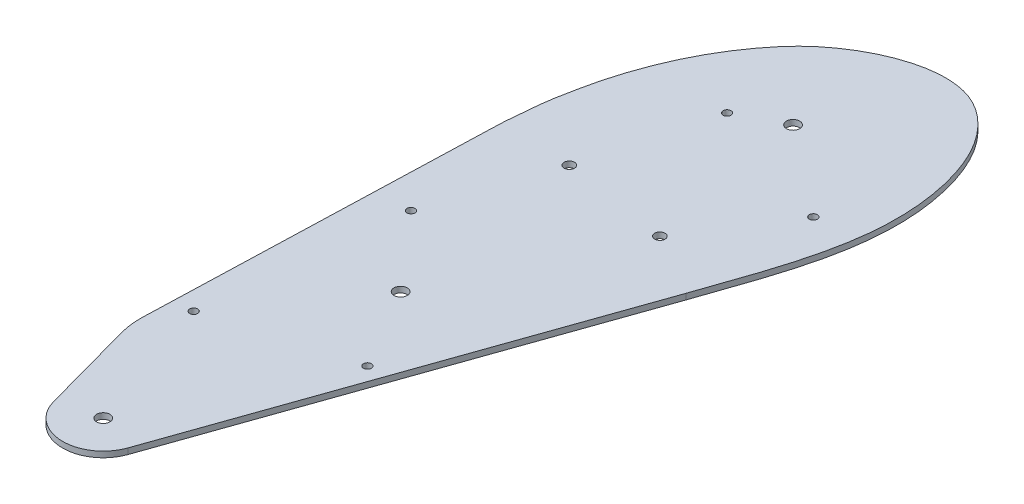
from build123d import *

# Parameters (mm, degrees)
SKETCH1_R           = 2.455
SKETCH1_R_2         = 1.475
SKETCH1_R_3         = 1.925
BOSS_EXTRUDE1_DEPTH = 2.15


with BuildPart() as part:
    # Sketch1 → Boss-Extrude1 (new body)
    with BuildSketch(Plane(origin=(0, 0, 0), x_dir=(1, 0, 0), z_dir=(0, 1, 0))):
        with BuildLine():
            Line((-82.919787444, -128.698908445), (-29.140629004, 24.317395253))
            add(Edge.make_bspline(
                [(-29.140629004, 24.317395253), (-23.337858539, 41.277059327), (-12.859922069, 68.46207501), (-14.319919643, 106.433004768), (-23.539271508, 129.054084446), (-49.289871518, 148.405248856), (-78.031844676, 135.576474168), (-101.152133843, 109.291651208), (-108.95092469, 92.729531905), (-113.164975056, 76.676804997)],
                knots=[0.130450955, 0.130450955, 0.130450955, 0.130450955, 0.339996476, 0.443939453, 0.557712873, 0.600920567, 0.79656388, 0.817312416, 1, 1, 1, 1], degree=3))
            add(Edge.make_bspline(
                [(-113.164975056, 76.676804997), (-114.293306759, 72.049304665), (-115.240161991, 67.388956151), (-116.086927837, 62.766035919)],
                knots=[0.01328584, 0.01328584, 0.01328584, 0.01328584, 0.075217512, 0.075217512, 0.075217512, 0.075217512], degree=3))
            add(Edge.make_bspline(
                [(-116.086927837, 62.766035919), (-116.348548805, 61.136035297), (-116.584476112, 59.498418841), (-116.795112166, 57.854481822)],
                knots=[0.060715751, 0.060715751, 0.060715751, 0.060715751, 0.078641805, 0.078641805, 0.078641805, 0.078641805], degree=3))
            Line((-116.795112166, 57.854481822), (-117.884405612, 45.850341496))
            add(Edge.make_bspline(
                [(-117.884405612, 45.850341496), (-117.972649156, 44.230573242), (-118.037929563, 42.60779089), (-118.080616055, 40.983182889)],
                knots=[0, 0, 0, 0, 0.017419058, 0.017419058, 0.017419058, 0.017419058], degree=3))
            Line((-118.080616055, 40.983182889), (-122.147838246, -84.01073193))
            ThreePointArc((-122.147838246, -84.01073193), (-121.955556235, -88.514252193), (-121.090684612, -92.938126535))
            Line((-121.090684612, -92.938126535), (-111.534695628, -127.701111051))
            ThreePointArc((-111.534695628, -127.701111051), (-97.593937187, -138.716134992), (-82.919787444, -128.698908445))
        make_face()
        with Locations((-97.07120722, -123.72524598)):
            Circle(SKETCH1_R, mode=Mode.SUBTRACT)
        with Locations((-114.601772791, -72.657901757)):
            Circle(SKETCH1_R_2, mode=Mode.SUBTRACT)
        with Locations((-64.843187058, -58.043882944)):
            Circle(SKETCH1_R_2, mode=Mode.SUBTRACT)
        with Locations((-82.539469357, -28.04652318)):
            Circle(SKETCH1_R, mode=Mode.SUBTRACT)
        with Locations((-106.618198832, -0.114198055)):
            Circle(SKETCH1_R_2, mode=Mode.SUBTRACT)
        with Locations((-52.307689331, 37.810609892)):
            Circle(SKETCH1_R_3, mode=Mode.SUBTRACT)
        with Locations((-91.854166633, 43.816950954)):
            Circle(SKETCH1_R_3, mode=Mode.SUBTRACT)
        with Locations((-30.041231326, 72.427446852)):
            Circle(SKETCH1_R_2, mode=Mode.SUBTRACT)
        with Locations((-79.40873095, 89.814244628)):
            Circle(SKETCH1_R_2, mode=Mode.SUBTRACT)
        with Locations((-63.361132615, 98.225969641)):
            Circle(SKETCH1_R, mode=Mode.SUBTRACT)
    extrude(amount=BOSS_EXTRUDE1_DEPTH)


solid = part.part
